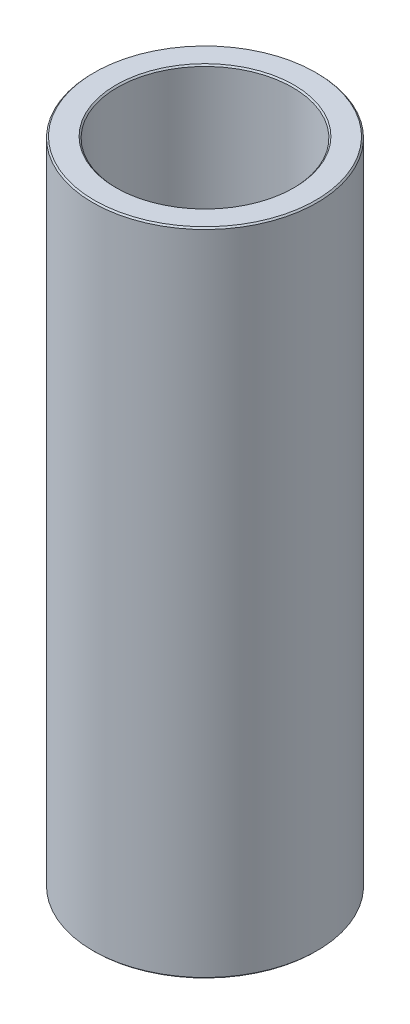
from build123d import *

# Parameters (mm, degrees)
SKETCH1_R           = 35
BOSS_EXTRUDE1_DEPTH = 203.105967649
SKETCH2_R           = 27.36149988
CUT_EXTRUDE1_DEPTH  = 210.050314744
CHAMFER1_SIZE       = 0.441228143


with BuildPart() as part:
    # Sketch1 → Boss-Extrude1 (new body)
    with BuildSketch(Plane(origin=(0, 0, 0), x_dir=(1, 0, 0), z_dir=(0, 1, 0))):
        Circle(SKETCH1_R)
    extrude(amount=BOSS_EXTRUDE1_DEPTH)

    # Sketch2 → Cut-Extrude1 (cut, through all)
    with BuildSketch(Plane(origin=(0, 0, 0), x_dir=(1, 0, 0), z_dir=(0, 1, 0))):
        Circle(SKETCH2_R)
    extrude(amount=CUT_EXTRUDE1_DEPTH, mode=Mode.SUBTRACT)

    # Chamfer1
    chamfer1_edges = [part.edges().sort_by_distance(p)[0] for p in [
        (-27.36149988, 203.105967649, 0),
        (-27.36149988, 0, 0),
        (-35, 0, 0),
        (-35, 203.105967649, 0),
    ]]
    chamfer(chamfer1_edges, length=CHAMFER1_SIZE)


solid = part.part
